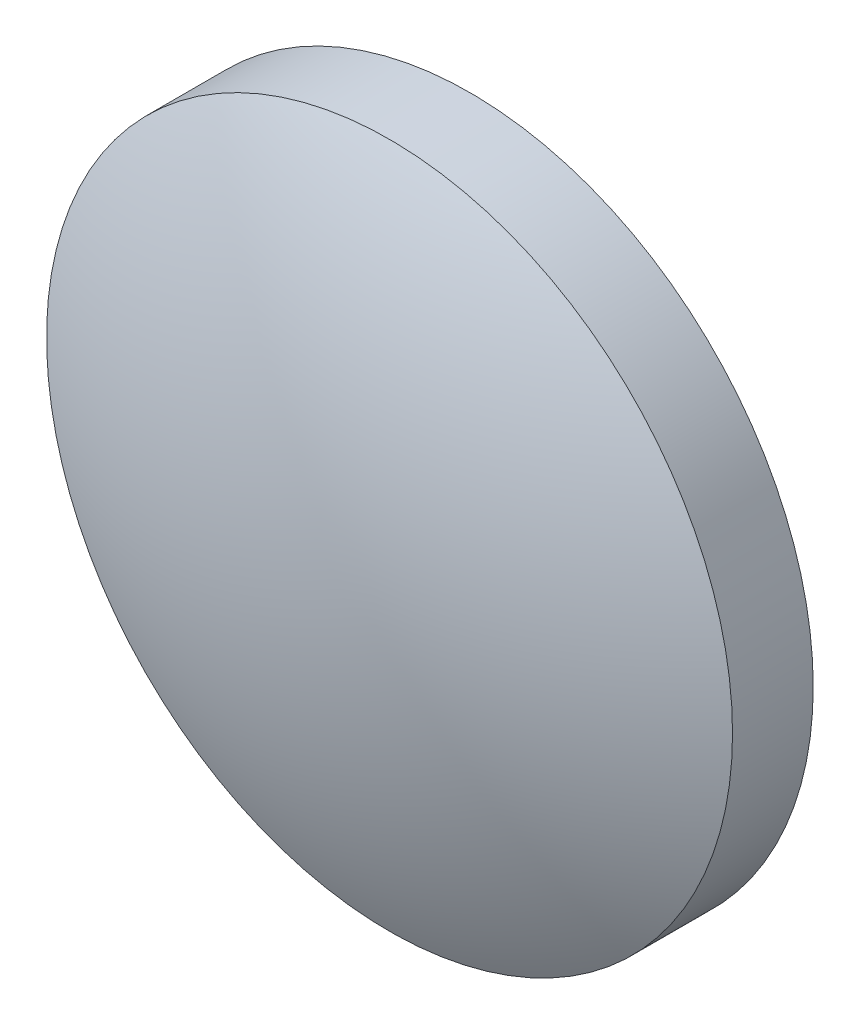
from build123d import *

# Parameters (mm, degrees)
SKETCH8_R           = 85
BOSS_EXTRUDE5_DEPTH = 20
DOME4_FACE_RADIUS   = 85
DOME4_HEIGHT        = 20
HOLE5_OUTLINE_R     = 80
HOLE5_DEPTH         = 16


# Read off the part's stored shape, not the designer's step: Hole5
with BuildPart() as part:
    # Sketch8 → Boss-Extrude5 (new body)
    with BuildSketch(Plane.XY):
        Circle(SKETCH8_R)
    extrude(amount=BOSS_EXTRUDE5_DEPTH)

    # Dome4: a dome of height H over a round flat face of radius A is a cap of a sphere of radius (A * A + H * H) / (2 * H)
    dome4_r = (DOME4_FACE_RADIUS * DOME4_FACE_RADIUS + DOME4_HEIGHT * DOME4_HEIGHT) / (2 * DOME4_HEIGHT)
    dome4_base = Plane((0, 0, 20), z_dir=(0, 0, 1))
    with Locations(dome4_base.offset(DOME4_HEIGHT - dome4_r)):
        dome4_ball = Sphere(dome4_r, mode=Mode.PRIVATE)
    add(split(dome4_ball, bisect_by=dome4_base, keep=Keep.TOP, mode=Mode.PRIVATE))

    # Hole5 outline → Hole5 (cut)
    with BuildSketch(Plane.XY):
        with Locations((-0.204435363, 1.845559102)):
            Circle(HOLE5_OUTLINE_R)
    extrude(amount=HOLE5_DEPTH, mode=Mode.SUBTRACT)


solid = part.part
